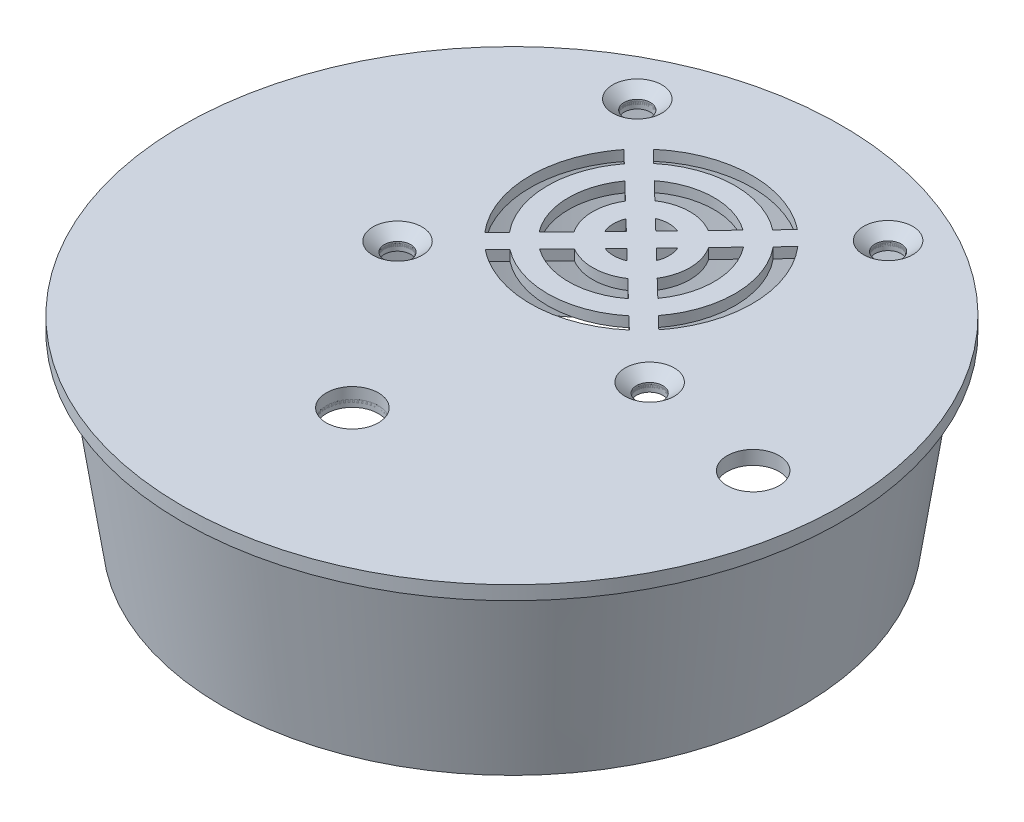
from build123d import *

# Parameters (mm, degrees)
SKETCH2_R                                 = 20.5
CUT_EXTRUDE1_DEPTH                        = 0.6
VENT2_START                               = -1.5
VENT2_DEPTH                               = 1.5
SKETCH5_R                                 = 8
BOSS_EXTRUDE1_DEPTH                       = 0.5
SKETCH5_R_2                               = 27
SKETCH5_R_3                               = 23
BOSS_EXTRUDE1_2_DEPTH                     = 0.5
CUT_EXTRUDE3_START                        = -2.1
SKETCH4_R                                 = 3.75
CUT_EXTRUDE3_DEPTH                        = 5
CSK_FOR_6_FLAT_HEAD_MACHINE_SCREW_2_COUNT = 2
CSK_FOR_6_FLAT_HEAD_MACHINE_SCREW_2_PITCH = 35.752604118
CSK_FOR_6_FLAT_HEAD_MACHINE_SCREW_3_COUNT = 2
CSK_FOR_6_FLAT_HEAD_MACHINE_SCREW_3_PITCH = 49.999911124
CSK_FOR_6_FLAT_HEAD_MACHINE_SCREW_4_COUNT = 2
CSK_FOR_6_FLAT_HEAD_MACHINE_SCREW_4_PITCH = 34.85820653


# Read off the part's stored shape, not the designer's step: Vent2
with BuildPart() as part:
    # Sketch1 → Revolve1 (revolve)
    with BuildSketch(Plane.XY, mode=Mode.PRIVATE) as revolve1_sk:
        with BuildLine():
            Line((0, 0), (-47.5, 0))
            Line((-47.5, 0), (-47.5, -2))
            Line((-47.5, -2), (-45.5, -2))
            Line((-45.5, -2), (-41.702855897, -27.901871877))
            Line((-41.702855897, -27.901871877), (-39.681479372, -27.901871877))
            Line((-39.681479372, -27.901871877), (-43.310762695, -3.145046985))
            ThreePointArc((-43.310762695, -3.145046985), (-43.077990749, -2.346183124), (-42.321337927, -2))
            Line((-42.321337927, -2), (0, -2))
            Line((0, -2), (0, 0))
        make_face()
    revolve(revolve1_sk.sketch.rotate(Axis((0, 0, 0), (0, -1, 0)), 270), axis=Axis((0, 0, 0), (0, -1, 0)))

    # Sketch2 → Cut-Extrude1 (cut)
    with BuildSketch(Plane(origin=(0, -2.1, 0), x_dir=(-1, 0, 0), z_dir=(0, -1, 0))):
        with Locations(Location((0.060176342, 18.631858505, 0), (0, 0, 90))):
            Circle(SKETCH2_R)
    extrude(amount=-CUT_EXTRUDE1_DEPTH, mode=Mode.SUBTRACT)

    # Vent2 outline → Vent2 (cut)
    with BuildSketch(Plane(origin=(0, 0, 0), x_dir=(1, 0, 0), z_dir=(0, 1, 0)).offset(VENT2_START)):
        with BuildLine():
            add(Edge.make_bspline(
                [(10.255737776, 6.665135333), (9.770281428, 6.248773483), (8.424181889, 5.227314992), (6.001411944, 3.932317477), (2.980573994, 3.015956303), (-0.160992599, 2.706539001), (-3.302559192, 3.015956303), (-6.323397142, 3.932317477), (-8.581189403, 5.139132583), (-9.793316444, 6.026006126), (-10.14753702, 6.308998079)],
                knots=[0.637164858, 0.637164858, 0.637164858, 0.637164858, 0.65625, 0.6875, 0.71875, 0.75, 0.78125, 0.8125, 0.84375, 0.85727963, 0.85727963, 0.85727963, 0.85727963], degree=3))
            Line((10.255737776, 6.665135333), (8.447937972, 8.410885126))
            add(Edge.make_bspline(
                [(8.447937972, 8.410885126), (8.092775234, 8.116857915), (7.013144541, 7.312355204), (5.038536234, 6.256905075), (2.489704214, 5.483725334), (-0.160992599, 5.222654485), (-2.811689412, 5.483725334), (-5.360521432, 6.256905075), (-7.19592993, 7.237951356), (-8.160993333, 7.931185051), (-8.40177288, 8.116765502)],
                knots=[0.639942769, 0.639942769, 0.639942769, 0.639942769, 0.65625, 0.6875, 0.71875, 0.75, 0.78125, 0.8125, 0.84375, 0.854501723, 0.854501723, 0.854501723, 0.854501723], degree=3))
            Line((-8.40177288, 8.116765502), (-10.14753702, 6.308998079))
        make_face()
        with BuildLine():
            add(Edge.make_bspline(
                [(11.98355017, 29.226408477), (12.39991202, 28.740952128), (13.42137051, 27.394852589), (14.716368025, 24.972082644), (15.632729199, 21.951244694), (15.942146502, 18.809678102), (15.632729199, 15.668111509), (14.716368025, 12.647273559), (13.509552919, 10.389481298), (12.622679377, 9.177354257), (12.339687423, 8.823133681)],
                knots=[0.387164858, 0.387164858, 0.387164858, 0.387164858, 0.40625, 0.4375, 0.46875, 0.5, 0.53125, 0.5625, 0.59375, 0.60727963, 0.60727963, 0.60727963, 0.60727963], degree=3))
            Line((11.98355017, 29.226408477), (10.237800389, 27.418608658))
            add(Edge.make_bspline(
                [(10.237800389, 27.418608658), (10.531827595, 27.063445924), (11.336330302, 25.983815235), (12.391780428, 24.009206935), (13.164960168, 21.460374914), (13.426031017, 18.809678102), (13.164960168, 16.158981289), (12.391780428, 13.610149268), (11.410734147, 11.77474077), (10.717500452, 10.809677367), (10.531920001, 10.56889782)],
                knots=[0.389942769, 0.389942769, 0.389942769, 0.389942769, 0.40625, 0.4375, 0.46875, 0.5, 0.53125, 0.5625, 0.59375, 0.604501723, 0.604501723, 0.604501723, 0.604501723], degree=3))
            Line((10.531920001, 10.56889782), (12.339687423, 8.823133681))
        make_face()
        with BuildLine():
            add(Edge.make_bspline(
                [(3.493903209, 20.435098695), (3.50784045, 20.403709035), (3.624603883, 20.131527571), (3.788877228, 19.595454768), (3.86406304, 18.809863571), (3.79008183, 18.036292061), (3.641907353, 17.544438095), (3.548381572, 17.31282249)],
                knots=[0.433401573, 0.433401573, 0.433401573, 0.433401573, 0.43749978, 0.468738662, 0.49999978, 0.531238662, 0.561043947, 0.561043947, 0.561043947, 0.561043947], degree=3))
            Line((3.493903209, 20.435098695), (1.960004657, 18.846700246))
            Line((1.960004657, 18.846700246), (3.548381572, 17.31282249))
        make_face()
        with BuildLine():
            Line((8.137094265, 25.243263786), (5.667672238, 22.68610242))
            add(Edge.make_bspline(
                [(5.667672238, 22.68610242), (5.918590962, 22.308810764), (6.3493212, 21.500889008), (6.748760688, 20.184113486), (6.884130758, 18.809678102), (6.748760688, 17.435242717), (6.373079072, 16.196786401), (5.99427185, 15.455517467), (5.799399319, 15.13903992)],
                knots=[0.406593406, 0.406593406, 0.406593406, 0.406593406, 0.4375, 0.46875, 0.5, 0.53125, 0.5625, 0.587850954, 0.587850954, 0.587850954, 0.587850954], degree=3))
            Line((5.799399319, 15.13903992), (8.356582973, 12.66959637))
            add(Edge.make_bspline(
                [(8.137094265, 25.243263786), (8.288195762, 25.048388619), (8.8344317, 24.29029044), (9.602275311, 22.853756083), (10.203637331, 20.871331178), (10.406692436, 18.809678102), (10.203637331, 16.748025025), (9.602275311, 14.76560012), (8.892301323, 13.437332213), (8.429346161, 12.770521294), (8.356582973, 12.66959637)],
                knots=[0.395036744, 0.395036744, 0.395036744, 0.395036744, 0.40625, 0.4375, 0.46875, 0.5, 0.53125, 0.5625, 0.59375, 0.599407752, 0.599407752, 0.599407752, 0.599407752], degree=3))
        make_face()
        with BuildLine():
            Line((6.272593101, 10.511591249), (3.715431731, 12.981013272))
            add(Edge.make_bspline(
                [(3.715431731, 12.981013272), (3.338140072, 12.730094545), (2.530218312, 12.299364304), (1.213442785, 11.899924815), (-0.160992599, 11.764554745), (-1.535427983, 11.899924815), (-2.773884299, 12.275606431), (-3.515153233, 12.654413653), (-3.831630781, 12.849286184)],
                knots=[0.656593406, 0.656593406, 0.656593406, 0.656593406, 0.6875, 0.71875, 0.75, 0.78125, 0.8125, 0.837850954, 0.837850954, 0.837850954, 0.837850954], degree=3))
            Line((-3.831630781, 12.849286184), (-6.30107433, 10.29210253))
            add(Edge.make_bspline(
                [(6.272593101, 10.511591249), (6.077717929, 10.360489748), (5.319619745, 9.814253806), (3.883085382, 9.046410192), (1.900660477, 8.445048171), (-0.160992599, 8.241993067), (-2.222645675, 8.445048171), (-4.20507058, 9.046410192), (-5.533338488, 9.75638418), (-6.200149407, 10.219339342), (-6.30107433, 10.29210253)],
                knots=[0.645036744, 0.645036744, 0.645036744, 0.645036744, 0.65625, 0.6875, 0.71875, 0.75, 0.78125, 0.8125, 0.84375, 0.849407752, 0.849407752, 0.849407752, 0.849407752], degree=3))
        make_face()
        with BuildLine():
            add(Edge.make_bspline(
                [(1.464427995, 15.154782294), (1.433038335, 15.140845053), (1.16085687, 15.024081619), (0.624784066, 14.859808274), (-0.160807125, 14.784622463), (-0.934378656, 14.858603669), (-1.426232575, 15.006778158), (-1.657848209, 15.100303933)],
                knots=[0.683401573, 0.683401573, 0.683401573, 0.683401573, 0.68749978, 0.718738662, 0.74999978, 0.781238662, 0.811043947, 0.811043947, 0.811043947, 0.811043947], degree=3))
            Line((1.464427995, 15.154782294), (-0.123970454, 16.688680845))
            Line((-0.123970454, 16.688680845), (-1.657848209, 15.100303933))
        make_face()
        with BuildLine():
            add(Edge.make_bspline(
                [(-12.305535368, 8.392947727), (-12.721897218, 8.878404075), (-13.743355708, 10.224503614), (-15.038353223, 12.647273559), (-15.954714397, 15.668111509), (-16.160992599, 17.762489237), (-16.160992599, 18.809678102), (-16.160992599, 19.856866966), (-15.954714397, 21.951244694), (-15.038353223, 24.972082644), (-13.831538117, 27.229874906), (-12.944664575, 28.442001946), (-12.661672621, 28.796222522)],
                knots=[0.887164858, 0.887164858, 0.887164858, 0.887164858, 0.90625, 0.9375, 0.96875, 1, 1, 1, 1.03125, 1.0625, 1.09375, 1.10727963, 1.10727963, 1.10727963, 1.10727963], degree=3))
            Line((-12.305535368, 8.392947727), (-10.559785587, 10.200747545))
            add(Edge.make_bspline(
                [(-10.559785587, 10.200747545), (-10.853812793, 10.555910279), (-11.6583155, 11.635540968), (-12.713765626, 13.610149268), (-13.486945366, 16.158981289), (-13.660992599, 17.926112497), (-13.660992599, 18.809678102), (-13.660992599, 19.693243706), (-13.486945366, 21.460374914), (-12.713765626, 24.009206935), (-11.732719343, 25.844615436), (-11.039485645, 26.809678842), (-10.853905192, 27.050458392)],
                knots=[0.889942769, 0.889942769, 0.889942769, 0.889942769, 0.90625, 0.9375, 0.96875, 1, 1, 1, 1.03125, 1.0625, 1.09375, 1.104501724, 1.104501724, 1.104501724, 1.104501724], degree=3))
            Line((-10.853905192, 27.050458392), (-12.661672621, 28.796222522))
        make_face()
        with BuildLine():
            add(Edge.make_bspline(
                [(-10.577722974, 30.95422087), (-10.092266626, 31.37058272), (-8.746167087, 32.392041211), (-6.323397142, 33.687038726), (-3.302559192, 34.6033999), (-0.160992599, 34.912817202), (2.980573994, 34.6033999), (6.001411944, 33.687038726), (8.259204205, 32.48022362), (9.471331246, 31.593350077), (9.825551822, 31.310358124)],
                knots=[0.137164858, 0.137164858, 0.137164858, 0.137164858, 0.15625, 0.1875, 0.21875, 0.25, 0.28125, 0.3125, 0.34375, 0.35727963, 0.35727963, 0.35727963, 0.35727963], degree=3))
            Line((-10.577722974, 30.95422087), (-8.769923155, 29.208471089))
            add(Edge.make_bspline(
                [(-8.769923155, 29.208471089), (-8.414760422, 29.502498296), (-7.335129733, 30.307001002), (-5.360521432, 31.362451128), (-2.811689412, 32.135630869), (-0.160992599, 32.396701718), (2.489704214, 32.135630869), (5.038536234, 31.362451128), (6.873944735, 30.381404845), (7.839008141, 29.688171148), (8.079787691, 29.502590695)],
                knots=[0.139942769, 0.139942769, 0.139942769, 0.139942769, 0.15625, 0.1875, 0.21875, 0.25, 0.28125, 0.3125, 0.34375, 0.354501724, 0.354501724, 0.354501724, 0.354501724], degree=3))
            Line((8.079787691, 29.502590695), (9.825551822, 31.310358124))
        make_face()
        with BuildLine():
            add(Edge.make_bspline(
                [(-1.786413184, 22.464573902), (-1.755023528, 22.478511145), (-1.482842108, 22.595274593), (-0.946769249, 22.759547925), (-0.161178073, 22.834733742), (0.612393443, 22.76075253), (1.104247409, 22.612578054), (1.335863015, 22.519052272)],
                knots=[0.183401572, 0.183401572, 0.183401572, 0.183401572, 0.18749978, 0.218738662, 0.24999978, 0.281238662, 0.311043947, 0.311043947, 0.311043947, 0.311043947], degree=3))
            Line((-1.786413184, 22.464573902), (-0.198014744, 20.930675358))
            Line((-0.198014744, 20.930675358), (1.335863015, 22.519052272))
        make_face()
        with BuildLine():
            Line((-6.594578284, 27.107764966), (-4.037416917, 24.638342939))
            add(Edge.make_bspline(
                [(-4.037416917, 24.638342939), (-3.660125261, 24.889261662), (-2.852203506, 25.319991901), (-1.535427983, 25.719431388), (-0.160992599, 25.854801458), (1.213442785, 25.719431388), (2.451899105, 25.343749771), (3.193168044, 24.964942546), (3.509645595, 24.770070012)],
                knots=[0.156593406, 0.156593406, 0.156593406, 0.156593406, 0.1875, 0.21875, 0.25, 0.28125, 0.3125, 0.337850954, 0.337850954, 0.337850954, 0.337850954], degree=3))
            Line((3.509645595, 24.770070012), (5.979089133, 27.327253673))
            add(Edge.make_bspline(
                [(-6.594578284, 27.107764966), (-6.399703117, 27.258866462), (-5.641604937, 27.8051024), (-4.20507058, 28.572946011), (-2.222645675, 29.174308032), (-0.160992599, 29.377363136), (1.900660477, 29.174308032), (3.883085382, 28.572946011), (5.21135329, 27.862972023), (5.878164209, 27.400016861), (5.979089133, 27.327253673)],
                knots=[0.145036744, 0.145036744, 0.145036744, 0.145036744, 0.15625, 0.1875, 0.21875, 0.25, 0.28125, 0.3125, 0.34375, 0.349407752, 0.349407752, 0.349407752, 0.349407752], degree=3))
        make_face()
        with BuildLine():
            Line((-8.459079451, 12.376092402), (-5.989657436, 14.933253783))
            add(Edge.make_bspline(
                [(-5.989657436, 14.933253783), (-6.240576159, 15.310545439), (-6.671306398, 16.118467195), (-7.070745886, 17.435242717), (-7.160992599, 18.351532973), (-7.160992599, 18.809678102), (-7.160992599, 19.26782323), (-7.070745886, 20.184113486), (-6.695064268, 21.422569806), (-6.316257044, 22.163838744), (-6.121384509, 22.480316295)],
                knots=[0.906593406, 0.906593406, 0.906593406, 0.906593406, 0.9375, 0.96875, 1, 1, 1, 1.03125, 1.0625, 1.087850954, 1.087850954, 1.087850954, 1.087850954], degree=3))
            Line((-6.121384509, 22.480316295), (-8.678568166, 24.94975984))
            add(Edge.make_bspline(
                [(-8.459079451, 12.376092402), (-8.610180952, 12.570967573), (-9.156416895, 13.329065757), (-9.924260509, 14.76560012), (-10.525622529, 16.748025025), (-10.660992599, 18.122460409), (-10.660992599, 18.809678102), (-10.660992599, 19.496895794), (-10.525622529, 20.871331178), (-9.924260509, 22.853756083), (-9.214286519, 24.182023993), (-8.751331355, 24.848834914), (-8.678568166, 24.94975984)],
                knots=[0.895036744, 0.895036744, 0.895036744, 0.895036744, 0.90625, 0.9375, 0.96875, 1, 1, 1, 1.03125, 1.0625, 1.09375, 1.099407752, 1.099407752, 1.099407752, 1.099407752], degree=3))
        make_face()
        with BuildLine():
            add(Edge.make_bspline(
                [(-3.815886832, 17.184259139), (-3.829824413, 17.215648307), (-3.946612198, 17.487871539), (-4.110915684, 18.023939002), (-4.161007133, 18.547736699), (-4.160992599, 18.809678102), (-4.16097807, 19.071524482), (-4.112014768, 19.583101661), (-3.963866591, 20.074959566), (-3.870365973, 20.306532946)],
                knots=[0.933401619, 0.933401619, 0.933401619, 0.933401619, 0.93749978, 0.968744333, 1, 1, 1, 1.031244329, 1.061043925, 1.061043925, 1.061043925, 1.061043925], degree=3))
            Line((-3.815886832, 17.184259139), (-2.281989855, 18.772655957))
            Line((-2.281989855, 18.772655957), (-3.870365973, 20.306532946))
        make_face()
    extrude(amount=VENT2_DEPTH, mode=Mode.SUBTRACT)


with BuildPart() as body_2:
    # Sketch5 → Boss-Extrude1 (new, symmetric)
    with BuildSketch(Plane(origin=(0, -2.1, 0), x_dir=(-1, 0, 0), z_dir=(0, -1, 0))):
        with Locations(Location((0, -23, 0), (0, 0, 90))):
            Circle(SKETCH5_R)
    extrude(amount=BOSS_EXTRUDE1_DEPTH, both=True)


with BuildPart() as body_3:
    # Sketch5 → Boss-Extrude1 2 (new, symmetric)
    with BuildSketch(Plane(origin=(0, -2.1, 0), x_dir=(-1, 0, 0), z_dir=(0, -1, 0))):
        with Locations(Location((0.060176342, 18.631858505, 0), (0, 0, 90))):
            Circle(SKETCH5_R_2)
        with Locations(Location((0.060176342, 18.631858505, 0), (0, 0, 90))):
            Circle(SKETCH5_R_3, mode=Mode.SUBTRACT)
    extrude(amount=BOSS_EXTRUDE1_2_DEPTH, both=True)


with BuildPart() as cut_extrude3_tool:
    # Sketch4 → Cut-Extrude3 (new body)
    with BuildSketch(Plane(origin=(0, -2.1, 0), x_dir=(-1, 0, 0), z_dir=(0, -1, 0)).offset(CUT_EXTRUDE3_START)):
        with Locations(Location((0, -23, 0), (0, 0, 90))):
            Circle(SKETCH4_R)
        with Locations(Location((-36.726988362, -1.961830662, 0), (0, 0, 270))):
            Circle(SKETCH4_R)
    extrude(amount=CUT_EXTRUDE3_DEPTH)


with BuildPart() as part_1:
    add(part.part)

    # Cut-Extrude3: cut by cut_extrude3_tool
    add(cut_extrude3_tool.part, mode=Mode.SUBTRACT)


with BuildPart() as body_2_1:
    add(body_2.part)

    # Cut-Extrude3: cut by cut_extrude3_tool
    add(cut_extrude3_tool.part, mode=Mode.SUBTRACT)


with BuildPart() as csk_for_6_flat_head_machine_screw_100_tool:
    # Sketch12 → CSK for #6 Flat Head Machine Screw (100)1 (revolve)
    with BuildSketch(Plane(origin=(17.737064479, 0, -36.481326095), x_dir=(0, 0, 1), z_dir=(1, 0, 0))):
        Polygon((0, 0), (0, 7.140824014), (1.89865, 6), (1.89865, 1.380025208), (3.5433, 0), align=None)
    csk_for_6_flat_head_machine_screw_100 = revolve(axis=Axis((17.737064479, 6.35, -36.481326095), (0, -1, 0)))


with BuildPart() as part_2:
    add(part_1.part)

    # CSK for #6 Flat Head Machine Screw (100)1: cut by csk_for_6_flat_head_machine_screw_100_tool
    add(csk_for_6_flat_head_machine_screw_100_tool.part, mode=Mode.SUBTRACT)


with BuildPart() as body_3_1:
    add(body_3.part)

    # CSK for #6 Flat Head Machine Screw (100)1: cut by csk_for_6_flat_head_machine_screw_100_tool
    add(csk_for_6_flat_head_machine_screw_100_tool.part, mode=Mode.SUBTRACT)


with BuildPart() as csk_for_6_flat_head_machine_screw_2_tool:
    # CSK for _6 Flat Head Machine Screw _ 2: CSK for #6 Flat Head Machine Screw (100)1 ×2
    with Locations(*[Vector(-0.9999361506789759, 0, 0.011300202003174257) * (i * CSK_FOR_6_FLAT_HEAD_MACHINE_SCREW_2_PITCH) for i in range(1, CSK_FOR_6_FLAT_HEAD_MACHINE_SCREW_2_COUNT)]):
        add(csk_for_6_flat_head_machine_screw_100)


with BuildPart() as part_3:
    add(part_2.part)

    # CSK for _6 Flat Head Machine Screw _ 2: cut by csk_for_6_flat_head_machine_screw_2_tool
    add(csk_for_6_flat_head_machine_screw_2_tool.part, mode=Mode.SUBTRACT)


with BuildPart() as body_3_2:
    add(body_3_1.part)

    # CSK for _6 Flat Head Machine Screw _ 2: cut by csk_for_6_flat_head_machine_screw_2_tool
    add(csk_for_6_flat_head_machine_screw_2_tool.part, mode=Mode.SUBTRACT)


with BuildPart() as csk_for_6_flat_head_machine_screw_3_tool:
    # CSK for _6 Flat Head Machine Screw _ 3: CSK for #6 Flat Head Machine Screw (100)1 ×2
    with Locations(*[Vector(-0.7057722881155953, 0, 0.7084387604642176) * (i * CSK_FOR_6_FLAT_HEAD_MACHINE_SCREW_3_PITCH) for i in range(1, CSK_FOR_6_FLAT_HEAD_MACHINE_SCREW_3_COUNT)]):
        add(csk_for_6_flat_head_machine_screw_100)


with BuildPart() as part_4:
    add(part_3.part)

    # CSK for _6 Flat Head Machine Screw _ 3: cut by csk_for_6_flat_head_machine_screw_3_tool
    add(csk_for_6_flat_head_machine_screw_3_tool.part, mode=Mode.SUBTRACT)


with BuildPart() as body_3_3:
    add(body_3_2.part)

    # CSK for _6 Flat Head Machine Screw _ 3: cut by csk_for_6_flat_head_machine_screw_3_tool
    add(csk_for_6_flat_head_machine_screw_3_tool.part, mode=Mode.SUBTRACT)


with BuildPart() as csk_for_6_flat_head_machine_screw_4_tool:
    # CSK for _6 Flat Head Machine Screw _ 4: CSK for #6 Flat Head Machine Screw (100)1 ×2
    with Locations(*[Vector(0.013963536368801646, 0, 0.9999025050734083) * (i * CSK_FOR_6_FLAT_HEAD_MACHINE_SCREW_4_PITCH) for i in range(1, CSK_FOR_6_FLAT_HEAD_MACHINE_SCREW_4_COUNT)]):
        add(csk_for_6_flat_head_machine_screw_100)


with BuildPart() as part_5:
    add(part_4.part)

    # CSK for _6 Flat Head Machine Screw _ 4: cut by csk_for_6_flat_head_machine_screw_4_tool
    add(csk_for_6_flat_head_machine_screw_4_tool.part, mode=Mode.SUBTRACT)


with BuildPart() as body_3_4:
    add(body_3_3.part)

    # CSK for _6 Flat Head Machine Screw _ 4: cut by csk_for_6_flat_head_machine_screw_4_tool
    add(csk_for_6_flat_head_machine_screw_4_tool.part, mode=Mode.SUBTRACT)


solid = Compound([body_2_1.part, part_5.part, body_3_4.part])
